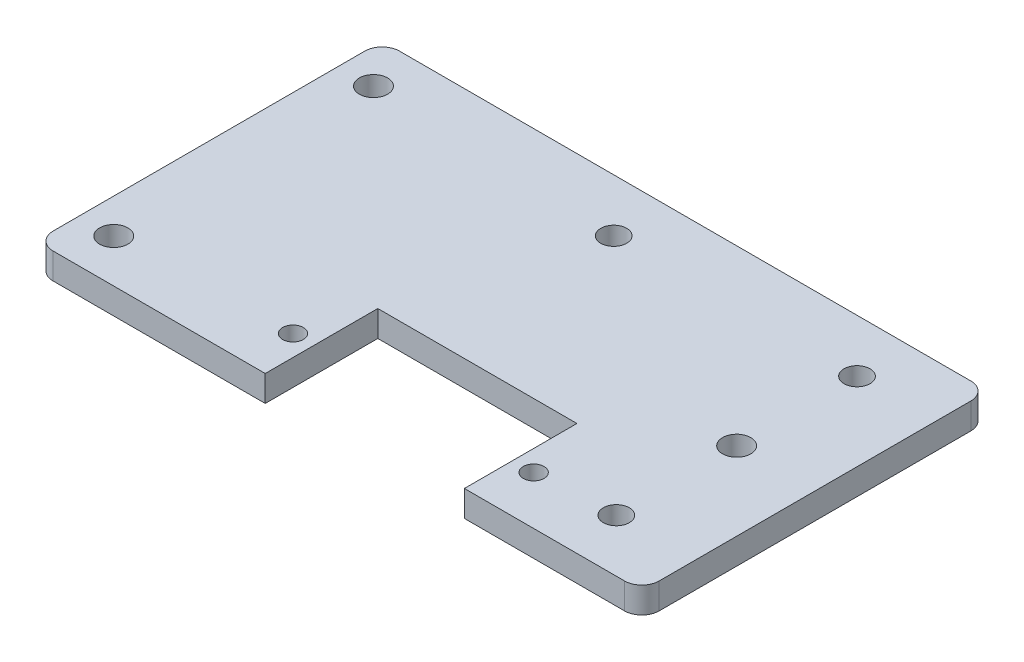
from build123d import *

# Parameters (mm, degrees)
SKETCH1_W             = 70
SKETCH1_H             = 40
BOSS_EXTRUDE1_DEPTH   = 3
F_3_0MM_DOWEL_HOLE1_D = 3
F_4_CLEARANCE_HOLE1_D = 3.2639
M2_CLEARANCE_HOLE1_D  = 2.4
SKETCH8_W             = 23
SKETCH8_H             = 13
CUT_EXTRUDE1_DEPTH    = 10
FILLET1_R             = 2


with BuildPart() as part:
    # Sketch1 → Boss-Extrude1 (new body)
    with BuildSketch(Plane(origin=(0, 0, 0), x_dir=(1, 0, 0), z_dir=(0, 1, 0))):
        Rectangle(SKETCH1_W, SKETCH1_H)
    extrude(amount=BOSS_EXTRUDE1_DEPTH)

    # Ø3.0mm Dowel Hole1 (through all)
    with Locations(Plane(origin=(0, 3, 0), x_dir=(1, 0, 0), z_dir=(0, 1, 0))):
        with Locations((-2.15, 13.9), (25.95, 13.9), (25.95, -13.9)):
            Hole(F_3_0MM_DOWEL_HOLE1_D / 2)

    # #4 Clearance Hole1 (through all)
    with Locations(Plane(origin=(0, 3, 0), x_dir=(1, 0, 0), z_dir=(0, 1, 0))):
        with Locations((-31, 15), (-31, -15), (25.95, 0)):
            Hole(F_4_CLEARANCE_HOLE1_D / 2)

    # M2 Clearance Hole1 (through all)
    with Locations(Plane(origin=(0, 3, 0), x_dir=(1, 0, 0), z_dir=(0, 1, 0))):
        with Locations((-10.9, -14.4), (16.9, -14.4)):
            Hole(M2_CLEARANCE_HOLE1_D / 2)

    # Sketch8 → Cut-Extrude1 (cut)
    with BuildSketch(Plane(origin=(0, 3, 0), x_dir=(1, 0, 0), z_dir=(0, 1, 0))):
        with Locations((3, -13.5)):
            Rectangle(SKETCH8_W, SKETCH8_H)
    extrude(amount=-CUT_EXTRUDE1_DEPTH, mode=Mode.SUBTRACT)

    # Fillet1
    fillet1_edges = [part.edges().sort_by_distance(p)[0] for p in [
        (35, 1.5, -20),
        (35, 1.5, 20),
        (-35, 1.5, 20),
        (-35, 1.5, -20),
    ]]
    fillet(fillet1_edges, radius=FILLET1_R)


solid = part.part
